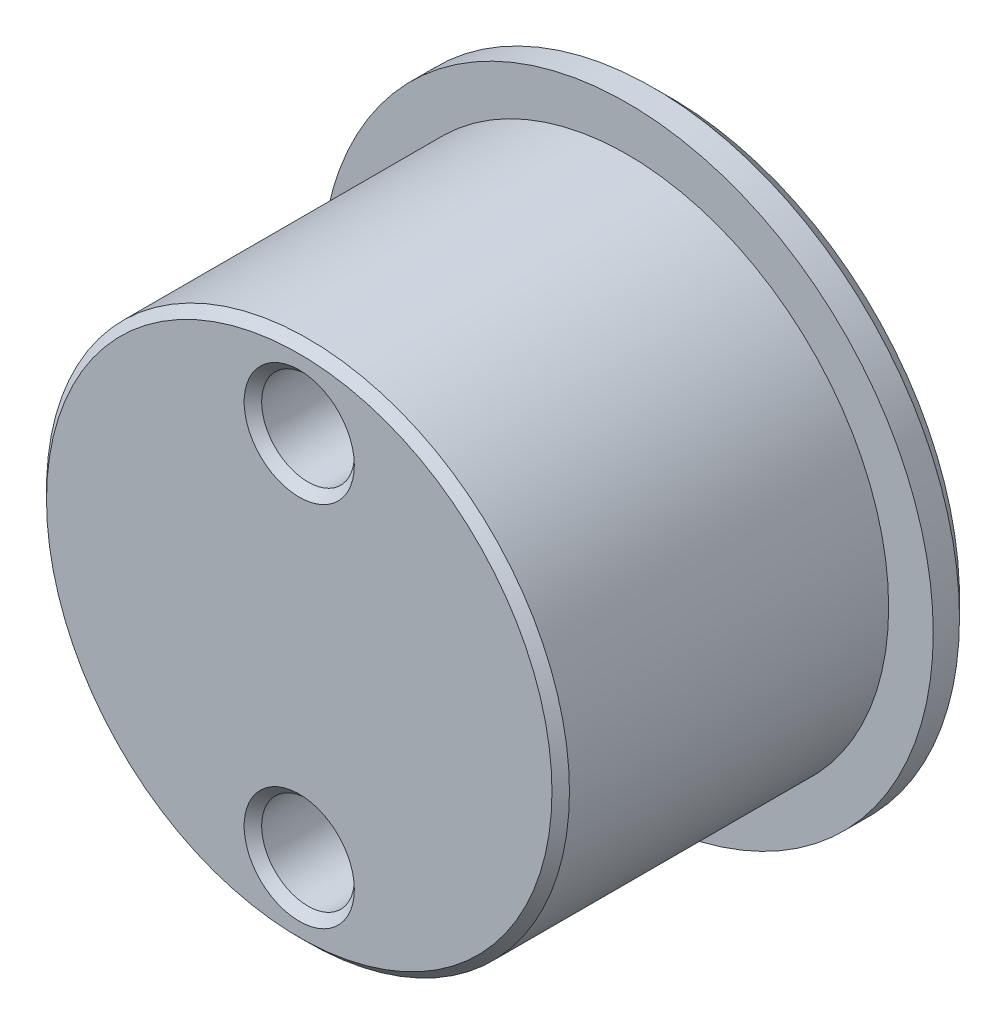
from build123d import *
from build123d.topology import SkipClean

# Parameters (mm, degrees)
SKETCH2_R           = 14.95
SKETCH2_R_2         = 2.65
BOSS_EXTRUDE1_DEPTH = 18.75
BOSS_EXTRUDE2_START = 2.5
SKETCH3_R           = 17.5
SKETCH3_R_2         = 2.65
BOSS_EXTRUDE2_DEPTH = 2.5
CUT_EXTRUDE1_DEPTH  = 6.4
CHAMFER1_SIZE       = 1
SKETCH5_R           = 2.65
BOSS_EXTRUDE3_DEPTH = 0.2
CHAMFER2_SIZE       = 0.5


with BuildPart() as part:
    # Sketch2 → Boss-Extrude1 (new body)
    with BuildSketch(Plane.XY):
        Circle(SKETCH2_R)
        with Locations((0, 10.5)):
            Circle(SKETCH2_R_2, mode=Mode.SUBTRACT)
        with Locations((0, -10.5)):
            Circle(SKETCH2_R_2, mode=Mode.SUBTRACT)
    extrude(amount=BOSS_EXTRUDE1_DEPTH)

    # Sketch3 → Boss-Extrude2 (add)
    with SkipClean():  # the faces are left unmerged after this step: merging them gives an invalid solid
        with BuildSketch(Plane(origin=(0, 0, 0), x_dir=(-1, 0, 0), z_dir=(0, 0, -1)).offset(BOSS_EXTRUDE2_START)):
            Circle(SKETCH3_R)
            with Locations((0, 10.5)):
                Circle(SKETCH3_R_2, mode=Mode.SUBTRACT)
            with Locations((0, -10.5)):
                Circle(SKETCH3_R_2, mode=Mode.SUBTRACT)
        extrude(amount=-BOSS_EXTRUDE2_DEPTH)

    # Sketch4 → Cut-Extrude1 (cut)
    with BuildSketch(Plane(origin=(0, 0, -2.5), x_dir=(-1, 0, 0), z_dir=(0, 0, -1))):
        Polygon((4.734272207, 10.5), (2.367136104, 14.6), (-2.367136104, 14.6), (-4.734272207, 10.5), (-2.367136104, 6.4), (2.367136104, 6.4), align=None)
        Polygon((4.734272207, -10.5), (2.367136104, -6.4), (-2.367136104, -6.4), (-4.734272207, -10.5), (-2.367136104, -14.6), (2.367136104, -14.6), align=None)
    extrude(amount=-CUT_EXTRUDE1_DEPTH, mode=Mode.SUBTRACT)

    # Chamfer1
    chamfer1_edges = [part.edges().sort_by_distance(p)[0] for p in [
        (17.5, 0, -2.5),
    ]]
    chamfer(chamfer1_edges, length=CHAMFER1_SIZE)

    # Sketch5 → Boss-Extrude3 (add)
    with BuildSketch(Plane(origin=(0, 0, 3.9), x_dir=(-1, 0, 0), z_dir=(0, 0, -1))):
        with Locations((0, 10.5)):
            Circle(SKETCH5_R)
        with Locations((0, -10.5)):
            Circle(SKETCH5_R)
    extrude(amount=-BOSS_EXTRUDE3_DEPTH)

    # Chamfer2
    chamfer2_edges = [part.edges().sort_by_distance(p)[0] for p in [
        (-3.550704156, -8.45, -2.5),
        (0, -6.4, -2.5),
        (3.550704156, -8.45, -2.5),
        (3.550704156, -12.55, -2.5),
        (0, -14.6, -2.5),
        (-3.550704156, -12.55, -2.5),
        (-3.550704156, 12.55, -2.5),
        (0, 14.6, -2.5),
        (3.550704156, 12.55, -2.5),
        (3.550704156, 8.45, -2.5),
        (0, 6.4, -2.5),
        (-3.550704156, 8.45, -2.5),
        (-14.95, 0, 18.75),
        (-2.65, 10.5, 18.75),
        (-2.65, -10.5, 18.75),
    ]]
    chamfer(chamfer2_edges, length=CHAMFER2_SIZE)


solid = part.part
